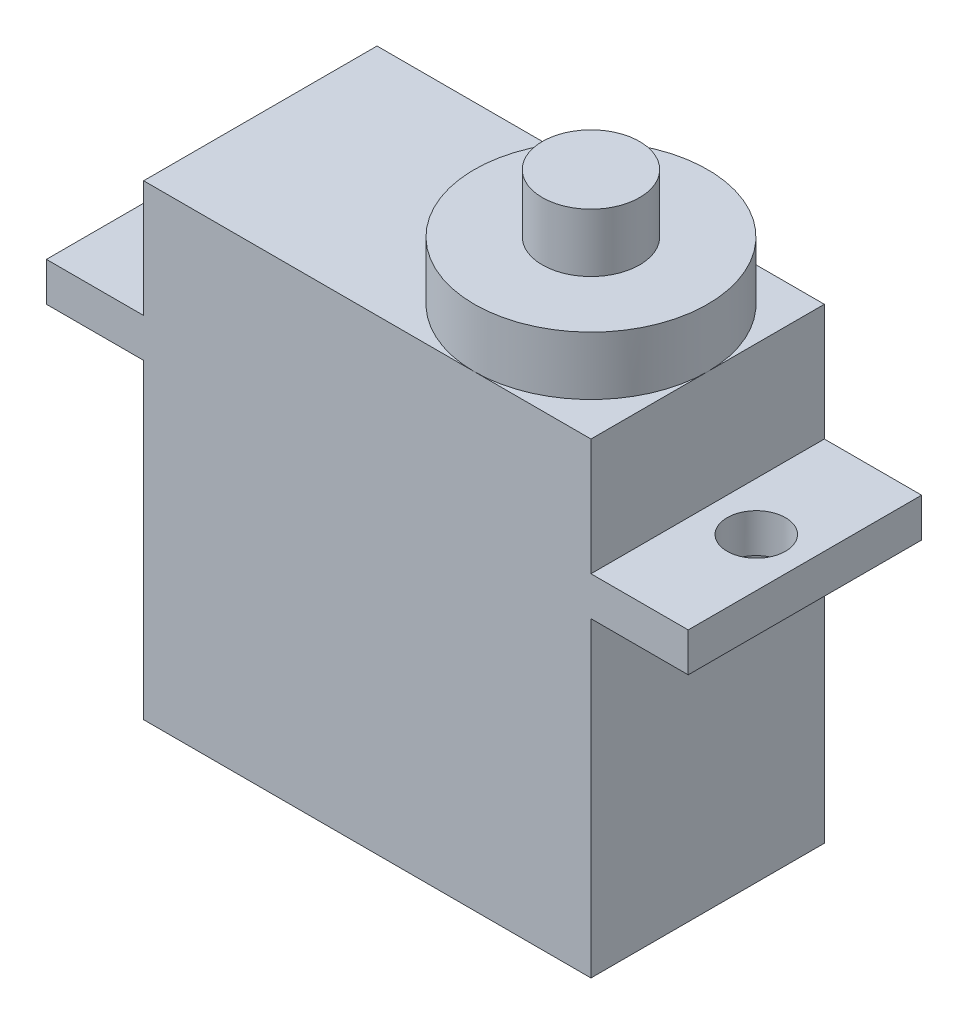
from build123d import *

# Parameters (mm, degrees)
SKETCH1_W           = 23
SKETCH1_H           = 12
BOSS_EXTRUDE1_DEPTH = 24
SKETCH2_W           = 12
SKETCH2_H           = 2
BOSS_EXTRUDE2_DEPTH = 5
SKETCH3_R           = 1.5
CUT_EXTRUDE1_DEPTH  = 5
SKETCH4_R           = 6
BOSS_EXTRUDE3_DEPTH = 3
SKETCH5_R           = 2.5
BOSS_EXTRUDE4_DEPTH = 3


with BuildPart() as part:
    # Sketch1 → Boss-Extrude1 (new body)
    with BuildSketch(Plane(origin=(0, 0, 0), x_dir=(1, 0, 0), z_dir=(0, 1, 0))):
        Rectangle(SKETCH1_W, SKETCH1_H)
    extrude(amount=BOSS_EXTRUDE1_DEPTH)

    # Sketch2 → Boss-Extrude2 (add)
    with BuildSketch(Plane.ZY.offset(11.5)):
        with Locations((0, 17)):
            Rectangle(SKETCH2_W, SKETCH2_H)
    boss_extrude2 = extrude(amount=BOSS_EXTRUDE2_DEPTH)

    # Sketch3 → Cut-Extrude1 (cut)
    with BuildSketch(Plane(origin=(0, 18, 0), x_dir=(1, 0, 0), z_dir=(0, 1, 0))):
        with Locations((-14, 0)):
            Circle(SKETCH3_R)
    cut_extrude1 = extrude(amount=-CUT_EXTRUDE1_DEPTH, mode=Mode.SUBTRACT)

    # Mirror1: Boss-Extrude2, Cut-Extrude1 across plane
    add(boss_extrude2.mirror(Plane(origin=(0, 0, 0), x_dir=(0, 0, 1), z_dir=(1, 0, 0))))
    add(cut_extrude1.mirror(Plane(origin=(0, 0, 0), x_dir=(0, 0, 1), z_dir=(1, 0, 0))), mode=Mode.SUBTRACT)

    # Sketch4 → Boss-Extrude3 (add)
    with BuildSketch(Plane(origin=(0, 24, 0), x_dir=(1, 0, 0), z_dir=(0, 1, 0))):
        with Locations((5.5, 0)):
            Circle(SKETCH4_R)
    extrude(amount=BOSS_EXTRUDE3_DEPTH)

    # Sketch5 → Boss-Extrude4 (add)
    with BuildSketch(Plane(origin=(0, 27, 0), x_dir=(1, 0, 0), z_dir=(0, 1, 0))):
        with Locations((5.5, 0)):
            Circle(SKETCH5_R)
    extrude(amount=BOSS_EXTRUDE4_DEPTH)


solid = part.part
